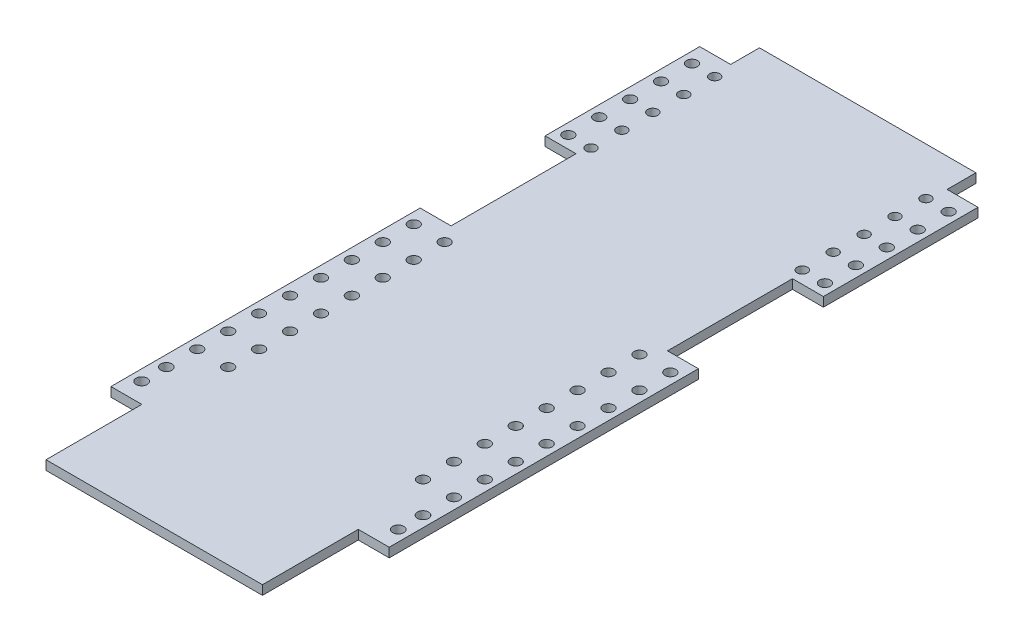
from build123d import *

# Parameters (mm, degrees)
BOSS_EXTRUDE5_DEPTH  = 3
M3_CLEARANCE_HOLE1_D = 3.6
SKETCH8_R            = 1.75
CUT_EXTRUDE1_DEPTH   = 249.962542564
SKETCH10_W           = 10
SKETCH10_H           = 50
SKETCH10_R           = 1.75
BOSS_EXTRUDE6_DEPTH  = 3
SKETCH11_R           = 1.65
CUT_EXTRUDE2_DEPTH   = 249.962542564
SKETCH12_W           = 70
SKETCH12_H           = 5
CUT_EXTRUDE3_DEPTH   = 10


with BuildPart() as part:
    # Sketch5 → Boss-Extrude5 (new body)
    with BuildSketch(Plane(origin=(0, 0, 0), x_dir=(1, 0, 0), z_dir=(0, 1, 0))):
        Polygon((80, 136), (70, 136), (70, 235.74), (0, 235.74), (0, 136), (-10, 136), (-10, 36), (0, 36), (0, 0), (70, 0), (70, 36), (80, 36), align=None)
    extrude(amount=BOSS_EXTRUDE5_DEPTH)

    # M3 Clearance Hole1 (through all)
    with Locations(Plane(origin=(0, 3, 0), x_dir=(1, 0, 0), z_dir=(0, 1, 0))):
        with Locations((76.5, 50.420635549), (76.5, 42.420635549)):
            m3_clearance_hole1 = Hole(M3_CLEARANCE_HOLE1_D / 2)

    # Sketch8 → Cut-Extrude1 (cut, through all)
    with BuildSketch(Plane(origin=(0, 3, 0), x_dir=(1, 0, 0), z_dir=(0, 1, 0))):
        with Locations((76.5, 60.420635549)):
            Circle(SKETCH8_R)
        with Locations((66.5, 60.420635549)):
            Circle(SKETCH8_R)
        with Locations((66.5, 70.420635549)):
            Circle(SKETCH8_R)
        with Locations((66.5, 80.420635549)):
            Circle(SKETCH8_R)
        with Locations((66.5, 90.420635549)):
            Circle(SKETCH8_R)
        with Locations((66.5, 100.420635549)):
            Circle(SKETCH8_R)
        with Locations((66.5, 110.420635549)):
            Circle(SKETCH8_R)
        with Locations((66.5, 120.420635549)):
            Circle(SKETCH8_R)
        with Locations((66.5, 130.420635549)):
            Circle(SKETCH8_R)
        with Locations((76.5, 70.420635549)):
            Circle(SKETCH8_R)
        with Locations((76.5, 80.420635549)):
            Circle(SKETCH8_R)
        with Locations((76.5, 90.420635549)):
            Circle(SKETCH8_R)
        with Locations((76.5, 100.420635549)):
            Circle(SKETCH8_R)
        with Locations((76.5, 110.420635549)):
            Circle(SKETCH8_R)
        with Locations((76.5, 120.420635549)):
            Circle(SKETCH8_R)
        with Locations((76.5, 130.420635549)):
            Circle(SKETCH8_R)
    cut_extrude1 = extrude(amount=-CUT_EXTRUDE1_DEPTH, mode=Mode.SUBTRACT)

    # Sketch10 → Boss-Extrude6 (add)
    with BuildSketch(Plane.XZ):
        with Locations((75, -201.420635549)):
            Rectangle(SKETCH10_W, SKETCH10_H)
        with Locations((76.5, -180.420635549)):
            Circle(SKETCH10_R, mode=Mode.SUBTRACT)
        with Locations((76.5, -190.420635549)):
            Circle(SKETCH10_R, mode=Mode.SUBTRACT)
        with Locations((76.5, -200.420635549)):
            Circle(SKETCH10_R, mode=Mode.SUBTRACT)
        with Locations((76.5, -210.420635549)):
            Circle(SKETCH10_R, mode=Mode.SUBTRACT)
        with Locations((76.5, -220.420635549)):
            Circle(SKETCH10_R, mode=Mode.SUBTRACT)
    boss_extrude6 = extrude(amount=-BOSS_EXTRUDE6_DEPTH)

    # Sketch11 → Cut-Extrude2 (cut, through all)
    with BuildSketch(Plane(origin=(0, 3, 0), x_dir=(1, 0, 0), z_dir=(0, 1, 0))):
        with Locations((69.165215785, 180.420635549)):
            Circle(SKETCH11_R)
        with Locations((69.165215785, 190.420635549)):
            Circle(SKETCH11_R)
        with Locations((69.165215785, 200.420635549)):
            Circle(SKETCH11_R)
        with Locations((69.165215785, 210.420635549)):
            Circle(SKETCH11_R)
        with Locations((69.165215785, 220.420635549)):
            Circle(SKETCH11_R)
    cut_extrude2 = extrude(amount=-CUT_EXTRUDE2_DEPTH, mode=Mode.SUBTRACT)

    # Mirror1: M3 Clearance Hole1, Cut-Extrude1, Boss-Extrude6, Cut-Extrude2 across plane
    add(m3_clearance_hole1.mirror(Plane.ZY.offset(-35)), mode=Mode.SUBTRACT)
    add(cut_extrude1.mirror(Plane.ZY.offset(-35)), mode=Mode.SUBTRACT)
    add(boss_extrude6.mirror(Plane.ZY.offset(-35)))
    add(cut_extrude2.mirror(Plane.ZY.offset(-35)), mode=Mode.SUBTRACT)

    # Sketch12 → Cut-Extrude3 (cut)
    with BuildSketch(Plane(origin=(0, 3, 0), x_dir=(1, 0, 0), z_dir=(0, 1, 0))):
        with Locations((35, 2.5)):
            Rectangle(SKETCH12_W, SKETCH12_H)
    extrude(amount=-CUT_EXTRUDE3_DEPTH, mode=Mode.SUBTRACT)


solid = part.part
